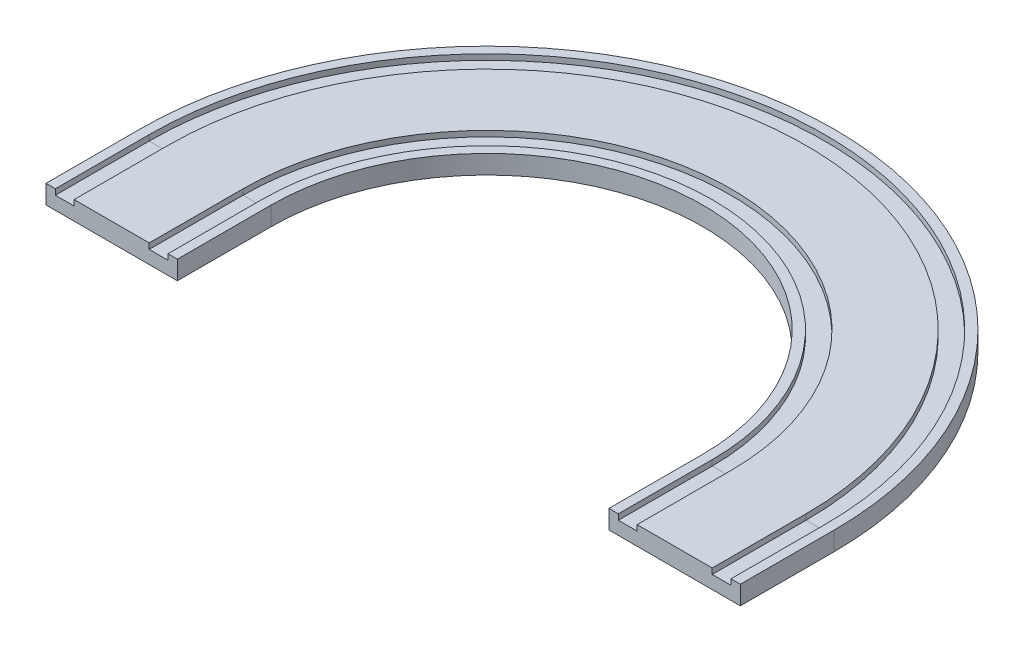
from build123d import *

# Parameters (mm, degrees)
BOSS_EXTRUDE1_DEPTH = 10
CUT_SWEEP1_START    = 7
CUT_SWEEP1_DEPTH    = 3


# Read off the part's stored shape, not the designer's step: Cut-Sweep1
with BuildPart() as part:
    # Sketch1 → Boss-Extrude1 (new body)
    with BuildSketch(Plane(origin=(0, 0, 0), x_dir=(1, 0, 0), z_dir=(0, 1, 0))):
        with BuildLine():
            Line((-35, 0), (35, 0))
            Line((35, 0), (35, 50))
            ThreePointArc((35, 50), (150, 165), (265, 50))
            Line((265, 50), (265, 0))
            Line((265, 0), (335, 0))
            Line((335, 0), (335, 50))
            ThreePointArc((335, 50), (150, 235), (-35, 50))
            Line((-35, 50), (-35, 0))
        make_face()
    extrude(amount=BOSS_EXTRUDE1_DEPTH)

    # Cut-Sweep1 outline → Cut-Sweep1 (cut)
    with BuildSketch(Plane(origin=(0, 0, 0), x_dir=(1, 0, 0), z_dir=(0, 1, 0)).offset(CUT_SWEEP1_START)):
        with BuildLine():
            Line((-30, 50), (-30, 0))
            Line((-30, 0), (-20, 0))
            Line((-20, 0), (-20, 50))
            ThreePointArc((-20, 50), (150, 220), (320, 50))
            Line((320, 50), (320, 0))
            Line((320, 0), (330, 0))
            Line((330, 0), (330, 50))
            ThreePointArc((330, 50), (150, 230), (-30, 50))
        make_face()
        with BuildLine():
            Line((20, 50), (20, 0))
            Line((20, 0), (30, 0))
            Line((30, 0), (30, 50))
            ThreePointArc((30, 50), (150, 170), (270, 50))
            Line((270, 50), (270, 0))
            Line((270, 0), (280, 0))
            Line((280, 0), (280, 50))
            ThreePointArc((280, 50), (150, 180), (20, 50))
        make_face()
    extrude(amount=CUT_SWEEP1_DEPTH, mode=Mode.SUBTRACT)


solid = part.part
